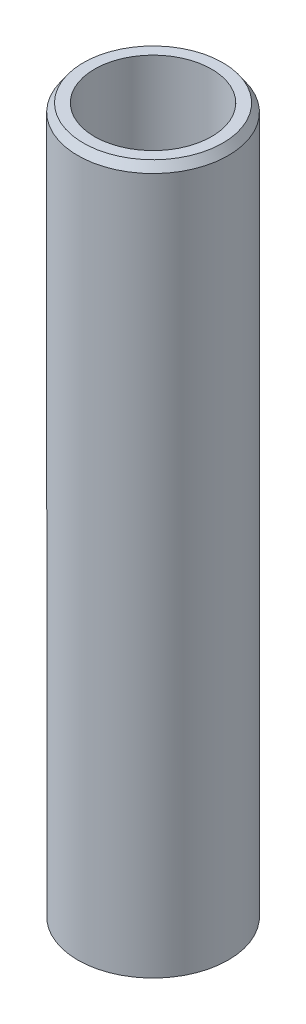
from build123d import *
from OCP.BRepFilletAPI import BRepFilletAPI_MakeChamfer

# Parameters (mm, degrees)
SKETCH1_R           = 47.5
BOSS_EXTRUDE1_DEPTH = 448.447720566
SKETCH2_R           = 36.946238739
CUT_EXTRUDE1_DEPTH  = 454.451053677
CHAMFER1_SIZE       = 5.078853205
CHAMFER1_SIZE2      = 3.490329388


with BuildPart() as part:
    # Sketch1 → Boss-Extrude1 (new body)
    with BuildSketch(Plane(origin=(0, 0, 0), x_dir=(1, 0, 0), z_dir=(0, 1, 0))):
        Circle(SKETCH1_R)
    extrude(amount=BOSS_EXTRUDE1_DEPTH)

    # Sketch2 → Cut-Extrude1 (cut, through all)
    with BuildSketch(Plane(origin=(0, 0, 0), x_dir=(1, 0, 0), z_dir=(0, 1, 0))):
        Circle(SKETCH2_R)
    extrude(amount=CUT_EXTRUDE1_DEPTH, mode=Mode.SUBTRACT)

    # Chamfer1: one chamfer whose edges measure the first distance from different faces: ONE call of the kernel's chamfer builder (chamfer() names one face for all edges)
    chamfer1_edges_1 = [part.edges().sort_by_distance(p)[0] for p in [
        (-47.5, 448.447720566, 0),
    ]]
    chamfer1_side_1 = [part.faces().sort_by_distance(p)[0] for p in [
        (-47.5, 224.223860283, 0),
    ]]
    chamfer1_edges_2 = [part.edges().sort_by_distance(p)[0] for p in [
        (-47.5, 0, 0),
    ]]
    chamfer1_side_2 = [part.faces().sort_by_distance(p)[0] for p in [
        (-46.156497116, 0, 0),
    ]]
    chamfer1 = BRepFilletAPI_MakeChamfer(part.part.solid().wrapped)
    for e in chamfer1_edges_1:
        chamfer1.Add(CHAMFER1_SIZE, CHAMFER1_SIZE2, e.wrapped, chamfer1_side_1[0].wrapped)  # the first distance lies on this face
    for e in chamfer1_edges_2:
        chamfer1.Add(CHAMFER1_SIZE, CHAMFER1_SIZE2, e.wrapped, chamfer1_side_2[0].wrapped)  # the first distance lies on this face
    add(Compound.cast(chamfer1.Shape()), mode=Mode.REPLACE)


solid = part.part
